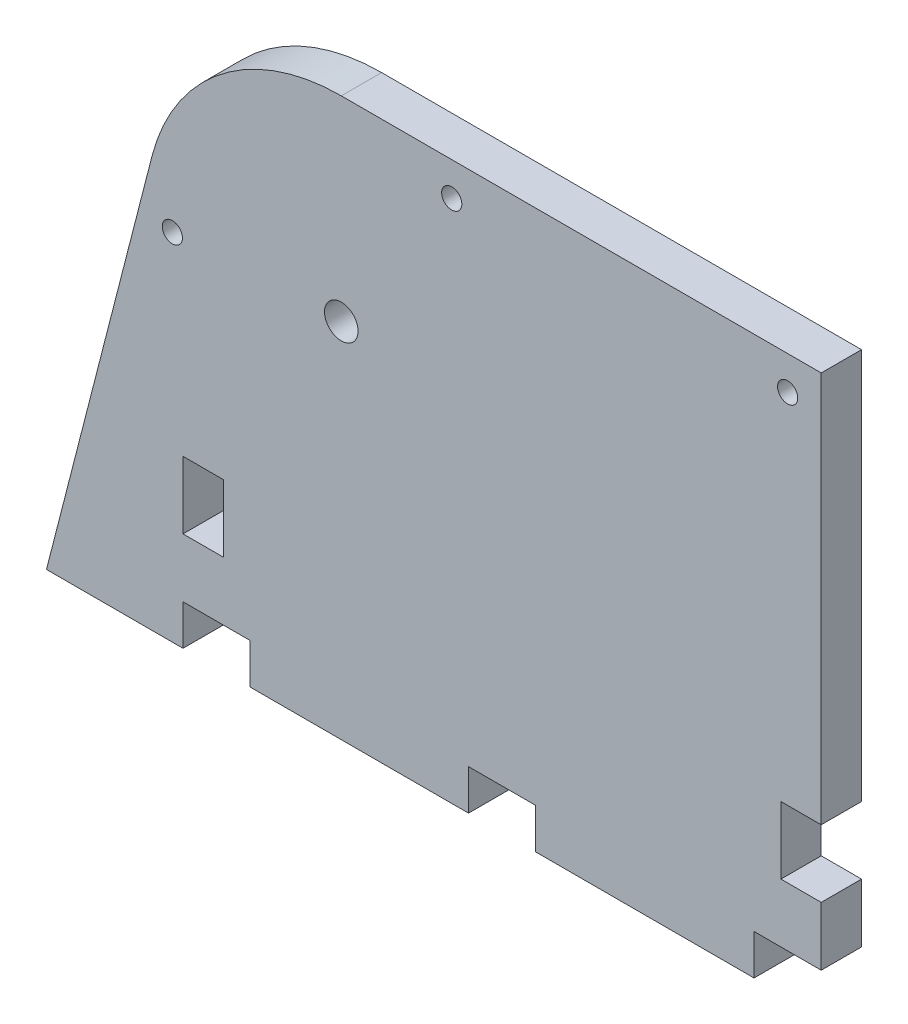
from build123d import *

# Parameters (mm, degrees)
SKETCH1_R           = 2.5
BOSS_EXTRUDE1_DEPTH = 6
SKETCH2_W           = 10
SKETCH2_H           = 6
SKETCH2_W_2         = 6
SKETCH2_H_2         = 10
CUT_EXTRUDE1_DEPTH  = 134.97761007
SKETCH3_R           = 1.5
CUT_EXTRUDE2_DEPTH  = 134.97761007
CAVITY1_OUTLINE_R   = 1.5
CAVITY1_DEPTH       = 6


# Read off the part's stored shape, not the designer's step: Cavity1
with BuildPart() as part:
    # Sketch1 → Boss-Extrude1 (new body)
    with BuildSketch(Plane.XY):
        with BuildLine():
            Line((-9.685424338, 2.488484559), (5.386220056, 61.148792841))
            ThreePointArc((5.386220056, 61.148792841), (15.733633721, 76.897010412), (33.561388608, 83))
            Line((33.561388608, 83), (105, 83))
            Line((105, 83), (105, 0))
            Line((105, 0), (-10.324792855, 0))
            Line((-10.324792855, 0), (-9.685424338, 2.488484559))
        make_face()
        with Locations((33.561388608, 53.909722104)):
            Circle(SKETCH1_R, mode=Mode.SUBTRACT)
    extrude(amount=BOSS_EXTRUDE1_DEPTH)

    # Sketch2 → Cut-Extrude1 (cut, through all)
    with BuildSketch(Plane.XY.offset(6)):
        with Locations((15, 3)):
            Rectangle(SKETCH2_W, SKETCH2_H)
        with Locations((57.5, 3)):
            Rectangle(SKETCH2_W, SKETCH2_H)
        with Locations((100, 3)):
            Rectangle(SKETCH2_W, SKETCH2_H)
        with Locations((102, 19.75)):
            Rectangle(SKETCH2_W_2, SKETCH2_H_2)
        with Locations((13, 19.75)):
            Rectangle(SKETCH2_W_2, SKETCH2_H_2)
    extrude(amount=-CUT_EXTRUDE1_DEPTH, mode=Mode.SUBTRACT)

    # Sketch3 → Cut-Extrude2 (cut, through all)
    with BuildSketch(Plane.XY.offset(6)):
        with Locations((50, 78)):
            Circle(SKETCH3_R)
        with Locations((100, 78)):
            Circle(SKETCH3_R)
    extrude(amount=-CUT_EXTRUDE2_DEPTH, mode=Mode.SUBTRACT)

    # Cavity1 outline → Cavity1 (cut)
    with BuildSketch(Plane.XY):
        with Locations((8.414860226, 52.844005614)):
            Circle(CAVITY1_OUTLINE_R)
    extrude(amount=CAVITY1_DEPTH, mode=Mode.SUBTRACT)


solid = part.part
